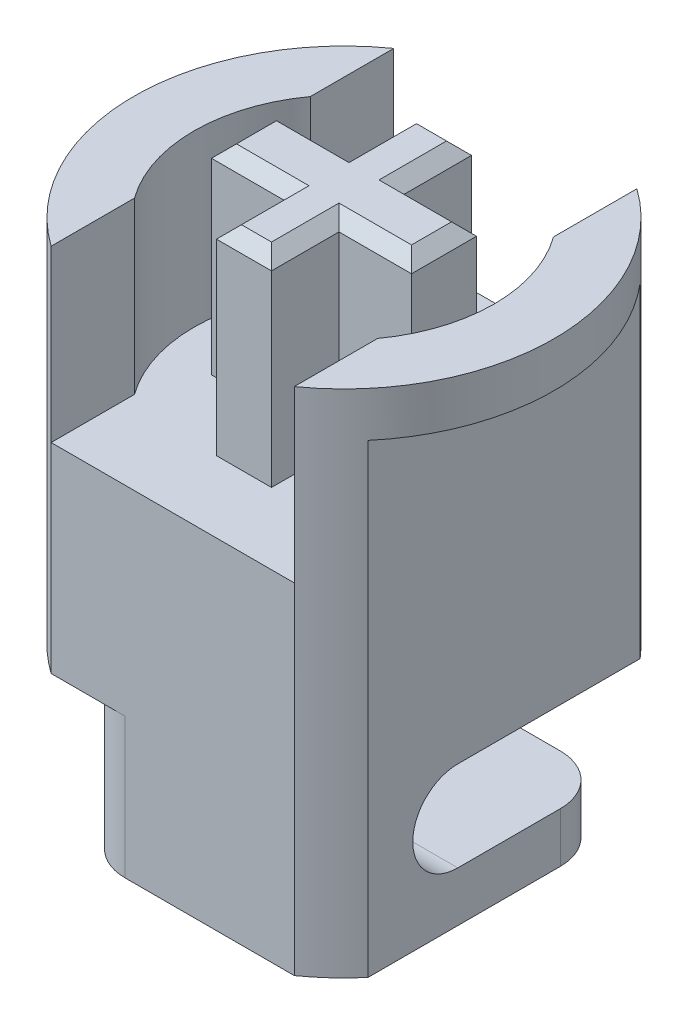
from build123d import *

# Parameters (mm, degrees)
BOSS_EXTRUDE1_DEPTH      = 3.4
BOSS_EXTRUDE1_DEPTH_BACK = 6.8
SKETCH1_R                = 4.2
SKETCH2_R                = 3
CUT_EXTRUDE1_DEPTH       = 10.028842672
CUT_EXTRUDE2_DEPTH       = 2.5
CUT_EXTRUDE2_DEPTH_BACK  = 10.028842672
SKETCH4_OUTSIDE_W        = 13.532
SKETCH4_OUTSIDE_H        = 13.532
SKETCH4_OUTSIDE_W_2      = 6.4
SKETCH4_OUTSIDE_H_2      = 6.85
SKETCH5_W                = 4.861841216
SKETCH5_H                = 8.4
CUT_EXTRUDE3_DEPTH       = 10.028842672
BOSS_EXTRUDE2_DEPTH      = 4
CHAMFER1_SIZE            = 0.25
CUT_EXTRUDE4_DEPTH       = 10.662847665
CUT_EXTRUDE5_DEPTH       = 9.695437022
CUT_EXTRUDE5_DEPTH_BACK  = 9.695437022
FILLET1_R                = 1


with BuildPart() as part:
    # Sketch1 → Boss-Extrude1 (new, two sides: drawn at the far end of the back side and taken through both)
    with BuildSketch(Plane(origin=(0, 0, 0), x_dir=(1, 0, 0), z_dir=(0, 1, 0)).offset(-BOSS_EXTRUDE1_DEPTH_BACK)):
        Circle(SKETCH1_R)
    extrude(amount=BOSS_EXTRUDE1_DEPTH + BOSS_EXTRUDE1_DEPTH_BACK)

    # Sketch2 → Cut-Extrude1 (cut, through all)
    with BuildSketch(Plane(origin=(0, 0, 0), x_dir=(1, 0, 0), z_dir=(0, 1, 0))):
        Circle(SKETCH2_R)
    extrude(amount=CUT_EXTRUDE1_DEPTH, mode=Mode.SUBTRACT)

    # Sketch4 outside → Cut-Extrude2 (cut, two sides: drawn at the far end of the back side and taken through both)
    with BuildSketch(Plane(origin=(0, 0, 0), x_dir=(1, 0, 0), z_dir=(0, 1, 0)).offset(-CUT_EXTRUDE2_DEPTH_BACK)):
        Rectangle(SKETCH4_OUTSIDE_W, SKETCH4_OUTSIDE_H)
        Rectangle(SKETCH4_OUTSIDE_W_2, SKETCH4_OUTSIDE_H_2, mode=Mode.SUBTRACT)
    extrude(amount=CUT_EXTRUDE2_DEPTH + CUT_EXTRUDE2_DEPTH_BACK, mode=Mode.SUBTRACT)

    # Sketch5 → Cut-Extrude3 (cut, through all)
    with BuildSketch(Plane(origin=(0, 0, 0), x_dir=(1, 0, 0), z_dir=(0, 1, 0))):
        Rectangle(SKETCH5_W, SKETCH5_H)
    extrude(amount=CUT_EXTRUDE3_DEPTH, mode=Mode.SUBTRACT)

    # Sketch3 → Boss-Extrude2 (add)
    with BuildSketch(Plane(origin=(0, 0, 0), x_dir=(1, 0, 0), z_dir=(0, 1, 0))):
        Polygon((-0.55, -0.65), (-0.55, -2), (0.55, -2), (0.55, -0.65), (2, -0.65), (2, 0.65), (0.55, 0.65), (0.55, 2), (-0.55, 2), (-0.55, 0.65), (-2, 0.65), (-2, -0.65), align=None)
    extrude(amount=BOSS_EXTRUDE2_DEPTH)

    # Chamfer1
    chamfer1_edges = [part.edges().sort_by_distance(p)[0] for p in [
        (0, 4, -2),
        (0.55, 4, -1.325),
        (1.275, 4, -0.65),
        (2, 4, 0),
        (1.275, 4, 0.65),
        (0.55, 4, 1.325),
        (0, 4, 2),
        (-0.55, 4, 1.325),
        (-1.275, 4, 0.65),
        (-2, 4, 0),
        (-1.275, 4, -0.65),
        (-0.55, 4, -1.325),
    ]]
    chamfer(chamfer1_edges, length=CHAMFER1_SIZE)

    # Sketch7 → Cut-Extrude4 (cut, through all)
    with BuildSketch(Plane(origin=(0, -4, 0), x_dir=(-1, 0, 0), z_dir=(0, -1, 0))):
        Polygon((-3.2, 2.125), (1.95, 2.125), (1.95, -3.425), (3.2, -3.425), (3.2, 2.125), (3.2, 3.425), (-3.2, 3.425), align=None)
    extrude(amount=CUT_EXTRUDE4_DEPTH, mode=Mode.SUBTRACT)

    # Sketch6 → Cut-Extrude5 (cut, two sides: drawn at the far end of the back side and taken through both)
    with BuildSketch(Plane(origin=(0, 0, 0), x_dir=(0, 0, -1), z_dir=(1, 0, 0)).offset(-CUT_EXTRUDE5_DEPTH_BACK)):
        with BuildLine():
            Line((2.125, -4), (-0.925, -4))
            ThreePointArc((-0.925, -4), (-1.825, -4.9), (-0.925, -5.8))
            Line((-0.925, -5.8), (2.125, -5.8))
            Line((2.125, -5.8), (2.125, -4))
        make_face()
    extrude(amount=CUT_EXTRUDE5_DEPTH + CUT_EXTRUDE5_DEPTH_BACK, mode=Mode.SUBTRACT)

    # Fillet1
    fillet1_edges = [part.edges().sort_by_distance(p)[0] for p in [
        (3.2, -6.3, -2.125),
        (-1.95, -6.3, -2.125),
        (-1.95, -5.4, 3.425),
    ]]
    fillet(fillet1_edges, radius=FILLET1_R)


solid = part.part
